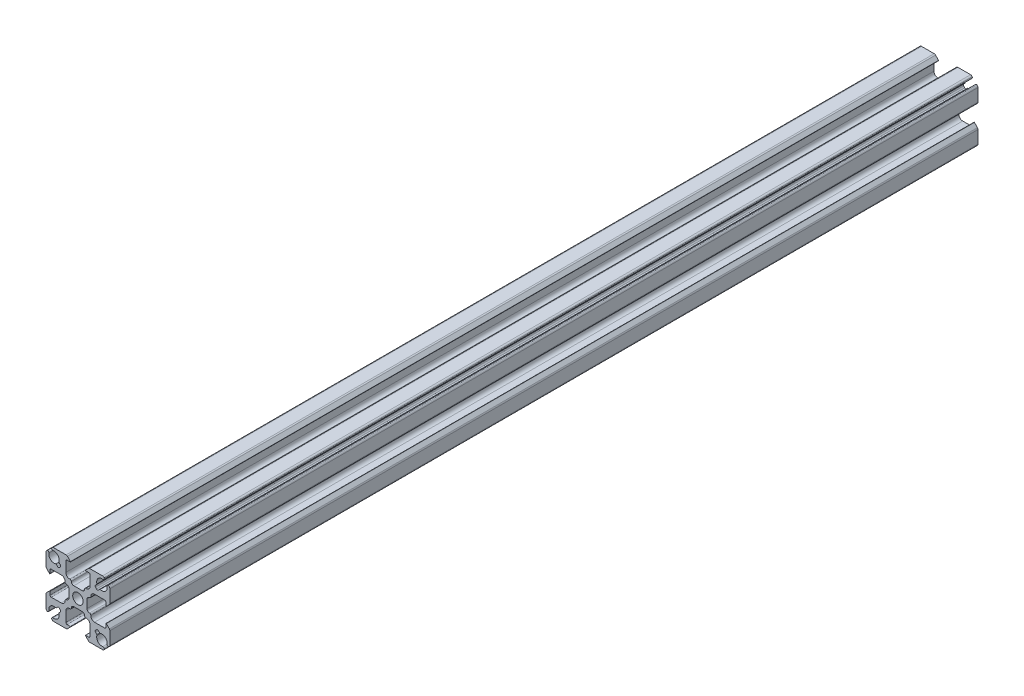
from build123d import *

# Parameters (mm, degrees)
SKETCH1_R                            = 2.08
BOSS_EXTRUDE1_DEPTH                  = 172.5549
SKETCH2_W                            = 2.5
SKETCH2_H                            = 16.3
TAP_DRILL_FOR_M6X1_0_TAP2_AT_2_COUNT = 2
TAP_DRILL_FOR_M6X1_0_TAP2_AT_2_PITCH = 135.89
SKETCH4_W                            = 2.5
SKETCH4_H                            = 16.3
TAP_DRILL_FOR_M6X1_0_TAP1_AT_2_COUNT = 2
TAP_DRILL_FOR_M6X1_0_TAP1_AT_2_PITCH = 120
TAP_DRILL_FOR_M6X1_0_TAP1_AT_3_COUNT = 2
TAP_DRILL_FOR_M6X1_0_TAP1_AT_3_PITCH = 240


with BuildPart() as part:
    # Sketch1 → Boss-Extrude1 (new, symmetric)
    with BuildSketch(Plane(origin=(0, 0, 0), x_dir=(-1, 0, 0), z_dir=(0, 0, -1))):
        with BuildLine():
            Line((-7.48853247, 8.61990332), (-6.985643798, 8.117014648))
            ThreePointArc((-6.985643798, 8.117014648), (-6.839197188, 7.763461257), (-6.985643798, 7.409907866))
            Line((-6.985643798, 7.409907866), (-7.409907866, 6.985643798))
            ThreePointArc((-7.409907866, 6.985643798), (-7.763461257, 6.839197188), (-8.117014648, 6.985643798))
            Line((-8.117014648, 6.985643798), (-8.61990332, 7.48853247))
            ThreePointArc((-8.61990332, 7.48853247), (-8.738774884, 7.554957329), (-8.874825936, 7.549228331))
            ThreePointArc((-8.874825936, 7.549228331), (-10.889377278, 7.955008076), (-11.572136222, 9.893284252))
            ThreePointArc((-11.572136222, 9.893284252), (-11.766795458, 10.383720777), (-12.292708824, 10.42656157))
            ThreePointArc((-12.292708824, 10.42656157), (-12.590129525, 10.150252615), (-12.7, 9.759440396))
            Line((-12.7, 9.759440396), (-12.7, 4.710660172))
            ThreePointArc((-12.7, 4.710660172), (-12.642909649, 4.423647598), (-12.480330086, 4.180330086))
            Line((-12.480330086, 4.180330086), (-11.270710678, 2.970710678))
            ThreePointArc((-11.270710678, 2.970710678), (-11.161731657, 2.949033403), (-11.1, 3.041421356))
            Line((-11.1, 3.041421356), (-11.1, 4.325))
            ThreePointArc((-11.1, 4.325), (-10.953553391, 4.678553391), (-10.6, 4.825))
            Line((-10.6, 4.825), (-6.6, 4.825))
            ThreePointArc((-6.6, 4.825), (-5.539339828, 4.385660172), (-5.1, 3.325))
            Line((-5.1, 3.325), (-5.1, 3.15))
            ThreePointArc((-5.1, 3.15), (-4.953553391, 2.796446609), (-4.6, 2.65))
            ThreePointArc((-4.6, 2.65), (-3.892893219, 2.357106781), (-3.6, 1.65))
            Line((-3.6, 1.65), (-3.6, -1.65))
            ThreePointArc((-3.6, -1.65), (-3.892893219, -2.357106781), (-4.6, -2.65))
            ThreePointArc((-4.6, -2.65), (-4.953553391, -2.796446609), (-5.1, -3.15))
            Line((-5.1, -3.15), (-5.1, -3.325))
            ThreePointArc((-5.1, -3.325), (-5.539339828, -4.385660172), (-6.6, -4.825))
            Line((-6.6, -4.825), (-10.6, -4.825))
            ThreePointArc((-10.6, -4.825), (-10.953553391, -4.678553391), (-11.1, -4.325))
            Line((-11.1, -4.325), (-11.1, -3.041421356))
            ThreePointArc((-11.1, -3.041421356), (-11.161731657, -2.949033403), (-11.270710678, -2.970710678))
            Line((-11.270710678, -2.970710678), (-12.480330086, -4.180330086))
            ThreePointArc((-12.480330086, -4.180330086), (-12.642909649, -4.423647598), (-12.7, -4.710660172))
            Line((-12.7, -4.710660172), (-12.7, -9.759440396))
            ThreePointArc((-12.7, -9.759440396), (-12.590129525, -10.150252615), (-12.292708824, -10.42656157))
            ThreePointArc((-12.292708824, -10.42656157), (-11.766795458, -10.383720777), (-11.572136222, -9.893284252))
            ThreePointArc((-11.572136222, -9.893284252), (-10.889377278, -7.955008076), (-8.874825936, -7.549228331))
            ThreePointArc((-8.874825936, -7.549228331), (-8.738774884, -7.554957329), (-8.61990332, -7.48853247))
            Line((-8.61990332, -7.48853247), (-8.117014648, -6.985643798))
            ThreePointArc((-8.117014648, -6.985643798), (-7.763461257, -6.839197188), (-7.409907866, -6.985643798))
            Line((-7.409907866, -6.985643798), (-6.985643798, -7.409907866))
            ThreePointArc((-6.985643798, -7.409907866), (-6.839197188, -7.763461257), (-6.985643798, -8.117014648))
            Line((-6.985643798, -8.117014648), (-7.48853247, -8.61990332))
            ThreePointArc((-7.48853247, -8.61990332), (-7.554957329, -8.738774884), (-7.549228331, -8.874825936))
            ThreePointArc((-7.549228331, -8.874825936), (-7.955008076, -10.889377278), (-9.893284252, -11.572136222))
            ThreePointArc((-9.893284252, -11.572136222), (-10.383720777, -11.766795458), (-10.42656157, -12.292708824))
            ThreePointArc((-10.42656157, -12.292708824), (-10.150252615, -12.590129525), (-9.759440396, -12.7))
            Line((-9.759440396, -12.7), (-4.710660172, -12.7))
            ThreePointArc((-4.710660172, -12.7), (-4.423647598, -12.642909649), (-4.180330086, -12.480330086))
            Line((-4.180330086, -12.480330086), (-2.970710678, -11.270710678))
            ThreePointArc((-2.970710678, -11.270710678), (-2.949033403, -11.161731657), (-3.041421356, -11.1))
            Line((-3.041421356, -11.1), (-4.325, -11.1))
            ThreePointArc((-4.325, -11.1), (-4.678553391, -10.953553391), (-4.825, -10.6))
            Line((-4.825, -10.6), (-4.825, -6.6))
            ThreePointArc((-4.825, -6.6), (-4.385660172, -5.539339828), (-3.325, -5.1))
            Line((-3.325, -5.1), (-3.15, -5.1))
            ThreePointArc((-3.15, -5.1), (-2.796446609, -4.953553391), (-2.65, -4.6))
            ThreePointArc((-2.65, -4.6), (-2.357106781, -3.892893219), (-1.65, -3.6))
            Line((-1.65, -3.6), (1.65, -3.6))
            ThreePointArc((1.65, -3.6), (2.357106781, -3.892893219), (2.65, -4.6))
            ThreePointArc((2.65, -4.6), (2.796446609, -4.953553391), (3.15, -5.1))
            Line((3.15, -5.1), (3.325, -5.1))
            ThreePointArc((3.325, -5.1), (4.385660172, -5.539339828), (4.825, -6.6))
            Line((4.825, -6.6), (4.825, -10.6))
            ThreePointArc((4.825, -10.6), (4.678553391, -10.953553391), (4.325, -11.1))
            Line((4.325, -11.1), (3.041421356, -11.1))
            ThreePointArc((3.041421356, -11.1), (2.949033403, -11.161731657), (2.970710678, -11.270710678))
            Line((2.970710678, -11.270710678), (4.180330086, -12.480330086))
            ThreePointArc((4.180330086, -12.480330086), (4.423647598, -12.642909649), (4.710660172, -12.7))
            Line((4.710660172, -12.7), (9.759440396, -12.7))
            ThreePointArc((9.759440396, -12.7), (10.150252615, -12.590129525), (10.42656157, -12.292708824))
            ThreePointArc((10.42656157, -12.292708824), (10.383720777, -11.766795458), (9.893284252, -11.572136222))
            ThreePointArc((9.893284252, -11.572136222), (7.955008076, -10.889377278), (7.549228331, -8.874825936))
            ThreePointArc((7.549228331, -8.874825936), (7.554957329, -8.738774884), (7.48853247, -8.61990332))
            Line((7.48853247, -8.61990332), (6.985643798, -8.117014648))
            ThreePointArc((6.985643798, -8.117014648), (6.839197188, -7.763461257), (6.985643798, -7.409907866))
            Line((6.985643798, -7.409907866), (7.409907866, -6.985643798))
            ThreePointArc((7.409907866, -6.985643798), (7.763461257, -6.839197188), (8.117014648, -6.985643798))
            Line((8.117014648, -6.985643798), (8.61990332, -7.48853247))
            ThreePointArc((8.61990332, -7.48853247), (8.738774884, -7.554957329), (8.874825936, -7.549228331))
            ThreePointArc((8.874825936, -7.549228331), (10.889377278, -7.955008076), (11.572136222, -9.893284252))
            ThreePointArc((11.572136222, -9.893284252), (11.766795458, -10.383720777), (12.292708824, -10.42656157))
            ThreePointArc((12.292708824, -10.42656157), (12.590129525, -10.150252615), (12.7, -9.759440396))
            Line((12.7, -9.759440396), (12.7, -4.710660172))
            ThreePointArc((12.7, -4.710660172), (12.642909649, -4.423647598), (12.480330086, -4.180330086))
            Line((12.480330086, -4.180330086), (11.270710678, -2.970710678))
            ThreePointArc((11.270710678, -2.970710678), (11.161731657, -2.949033403), (11.1, -3.041421356))
            Line((11.1, -3.041421356), (11.1, -4.325))
            ThreePointArc((11.1, -4.325), (10.953553391, -4.678553391), (10.6, -4.825))
            Line((10.6, -4.825), (6.6, -4.825))
            ThreePointArc((6.6, -4.825), (5.539339828, -4.385660172), (5.1, -3.325))
            Line((5.1, -3.325), (5.1, -3.15))
            ThreePointArc((5.1, -3.15), (4.953553391, -2.796446609), (4.6, -2.65))
            ThreePointArc((4.6, -2.65), (3.892893219, -2.357106781), (3.6, -1.65))
            Line((3.6, -1.65), (3.6, 1.65))
            ThreePointArc((3.6, 1.65), (3.892893219, 2.357106781), (4.6, 2.65))
            ThreePointArc((4.6, 2.65), (4.953553391, 2.796446609), (5.1, 3.15))
            Line((5.1, 3.15), (5.1, 3.325))
            ThreePointArc((5.1, 3.325), (5.539339828, 4.385660172), (6.6, 4.825))
            Line((6.6, 4.825), (10.6, 4.825))
            ThreePointArc((10.6, 4.825), (10.953553391, 4.678553391), (11.1, 4.325))
            Line((11.1, 4.325), (11.1, 3.041421356))
            ThreePointArc((11.1, 3.041421356), (11.161731657, 2.949033403), (11.270710678, 2.970710678))
            Line((11.270710678, 2.970710678), (12.480330086, 4.180330086))
            ThreePointArc((12.480330086, 4.180330086), (12.642909649, 4.423647598), (12.7, 4.710660172))
            Line((12.7, 4.710660172), (12.7, 9.759440396))
            ThreePointArc((12.7, 9.759440396), (12.590129525, 10.150252615), (12.292708824, 10.42656157))
            ThreePointArc((12.292708824, 10.42656157), (11.766795458, 10.383720777), (11.572136222, 9.893284252))
            ThreePointArc((11.572136222, 9.893284252), (10.889377278, 7.955008076), (8.874825936, 7.549228331))
            ThreePointArc((8.874825936, 7.549228331), (8.738774884, 7.554957329), (8.61990332, 7.48853247))
            Line((8.61990332, 7.48853247), (8.117014648, 6.985643798))
            ThreePointArc((8.117014648, 6.985643798), (7.763461257, 6.839197188), (7.409907866, 6.985643798))
            Line((7.409907866, 6.985643798), (6.985643798, 7.409907866))
            ThreePointArc((6.985643798, 7.409907866), (6.839197188, 7.763461257), (6.985643798, 8.117014648))
            Line((6.985643798, 8.117014648), (7.48853247, 8.61990332))
            ThreePointArc((7.48853247, 8.61990332), (7.554957329, 8.738774884), (7.549228331, 8.874825936))
            ThreePointArc((7.549228331, 8.874825936), (7.955008076, 10.889377278), (9.893284252, 11.572136222))
            ThreePointArc((9.893284252, 11.572136222), (10.383720777, 11.766795458), (10.42656157, 12.292708824))
            ThreePointArc((10.42656157, 12.292708824), (10.150252615, 12.590129525), (9.759440396, 12.7))
            Line((9.759440396, 12.7), (4.710660172, 12.7))
            ThreePointArc((4.710660172, 12.7), (4.423647598, 12.642909649), (4.180330086, 12.480330086))
            Line((4.180330086, 12.480330086), (2.970710678, 11.270710678))
            ThreePointArc((2.970710678, 11.270710678), (2.949033403, 11.161731657), (3.041421356, 11.1))
            Line((3.041421356, 11.1), (4.325, 11.1))
            ThreePointArc((4.325, 11.1), (4.678553391, 10.953553391), (4.825, 10.6))
            Line((4.825, 10.6), (4.825, 6.6))
            ThreePointArc((4.825, 6.6), (4.385660172, 5.539339828), (3.325, 5.1))
            Line((3.325, 5.1), (3.15, 5.1))
            ThreePointArc((3.15, 5.1), (2.796446609, 4.953553391), (2.65, 4.6))
            ThreePointArc((2.65, 4.6), (2.357106781, 3.892893219), (1.65, 3.6))
            Line((1.65, 3.6), (-1.65, 3.6))
            ThreePointArc((-1.65, 3.6), (-2.357106781, 3.892893219), (-2.65, 4.6))
            ThreePointArc((-2.65, 4.6), (-2.796446609, 4.953553391), (-3.15, 5.1))
            Line((-3.15, 5.1), (-3.325, 5.1))
            ThreePointArc((-3.325, 5.1), (-4.385660172, 5.539339828), (-4.825, 6.6))
            Line((-4.825, 6.6), (-4.825, 10.6))
            ThreePointArc((-4.825, 10.6), (-4.678553391, 10.953553391), (-4.325, 11.1))
            Line((-4.325, 11.1), (-3.041421356, 11.1))
            ThreePointArc((-3.041421356, 11.1), (-2.949033403, 11.161731657), (-2.970710678, 11.270710678))
            Line((-2.970710678, 11.270710678), (-4.180330086, 12.480330086))
            ThreePointArc((-4.180330086, 12.480330086), (-4.423647598, 12.642909649), (-4.710660172, 12.7))
            Line((-4.710660172, 12.7), (-9.759440396, 12.7))
            ThreePointArc((-9.759440396, 12.7), (-10.150252615, 12.590129525), (-10.42656157, 12.292708824))
            ThreePointArc((-10.42656157, 12.292708824), (-10.383720777, 11.766795458), (-9.893284252, 11.572136222))
            ThreePointArc((-9.893284252, 11.572136222), (-7.955008076, 10.889377278), (-7.549228331, 8.874825936))
            ThreePointArc((-7.549228331, 8.874825936), (-7.554957329, 8.738774884), (-7.48853247, 8.61990332))
        make_face()
        Circle(SKETCH1_R, mode=Mode.SUBTRACT)
    extrude(amount=BOSS_EXTRUDE1_DEPTH, both=True)

    # Sketch2 → Tap Drill for M6x1.0 Tap2 (revolve, cut)
    with BuildSketch(Plane(origin=(3.6, -4.450000001, 120.884899996), x_dir=(0, 0, -1), z_dir=(0, 1, 0))):
        with Locations((1.25, 8.15)):
            Rectangle(SKETCH2_W, SKETCH2_H)
    tap_drill_for_m6x1_0_tap2 = revolve(axis=Axis((9.95, -4.450000001, 120.884899996), (-1, 0, 0)), mode=Mode.SUBTRACT)

    # Tap Drill for M6x1.0 Tap2 at 2: Tap Drill for M6x1.0 Tap2 ×2
    with Locations(*[(0, 0, -i * TAP_DRILL_FOR_M6X1_0_TAP2_AT_2_PITCH) for i in range(1, TAP_DRILL_FOR_M6X1_0_TAP2_AT_2_COUNT)]):
        add(tap_drill_for_m6x1_0_tap2, mode=Mode.SUBTRACT)

    # Sketch4 → Tap Drill for M6x1.0 Tap1 (revolve, cut)
    with BuildSketch(Plane(origin=(-3.6, 0, 151.604899989), x_dir=(0, 0, 1), z_dir=(0, 1, 0))):
        with Locations((1.25, 8.15)):
            Rectangle(SKETCH4_W, SKETCH4_H)
    tap_drill_for_m6x1_0_tap1 = revolve(axis=Axis((-9.95, 0, 151.604899989), (1, 0, 0)), mode=Mode.SUBTRACT)

    # Tap Drill for M6x1.0 Tap1 at 2: Tap Drill for M6x1.0 Tap1 ×2
    with Locations(*[(0, 0, -i * TAP_DRILL_FOR_M6X1_0_TAP1_AT_2_PITCH) for i in range(1, TAP_DRILL_FOR_M6X1_0_TAP1_AT_2_COUNT)]):
        add(tap_drill_for_m6x1_0_tap1, mode=Mode.SUBTRACT)

    # Tap Drill for M6x1.0 Tap1 at 3: Tap Drill for M6x1.0 Tap1 ×2
    with Locations(*[(0, 0, -i * TAP_DRILL_FOR_M6X1_0_TAP1_AT_3_PITCH) for i in range(1, TAP_DRILL_FOR_M6X1_0_TAP1_AT_3_COUNT)]):
        add(tap_drill_for_m6x1_0_tap1, mode=Mode.SUBTRACT)


solid = part.part
